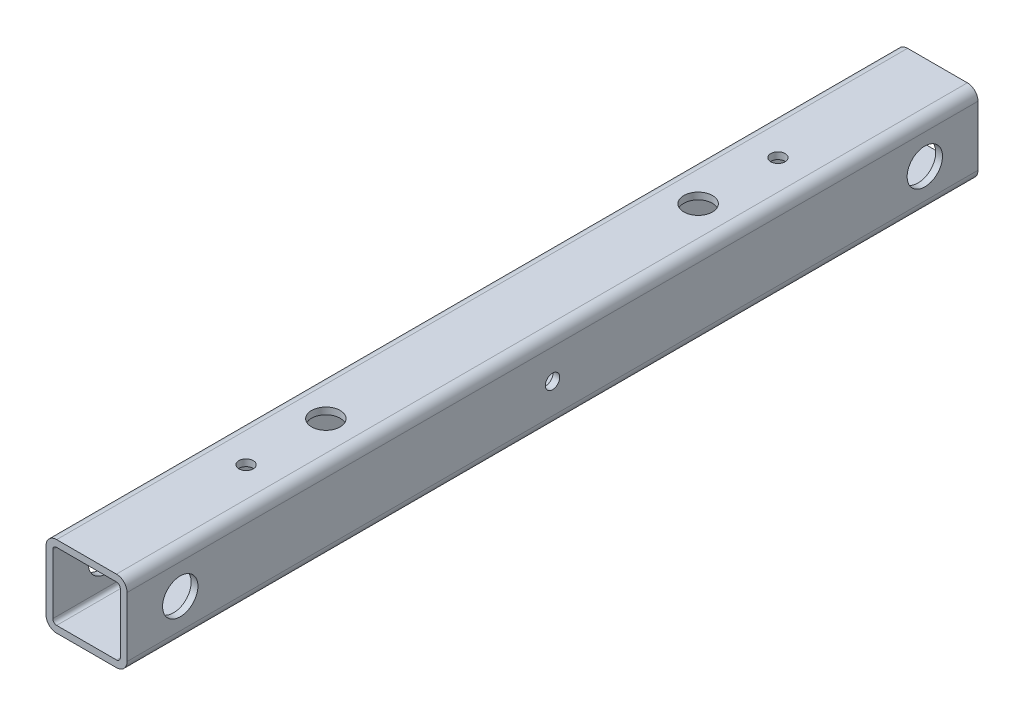
from build123d import *

# Parameters (mm, degrees)
BOSS_EXTRUDE1_DEPTH             = 400
CUT_EXTRUDE1_DEPTH              = 401.906229685
CUT_EXTRUDE1_DEPTH_BACK         = 401.906229685
SKETCH2_R                       = 8.3125
CUT_EXTRUDE2_DEPTH              = 401.906229685
CUT_EXTRUDE2_DEPTH_BACK         = 401.906229685
SKETCH3_R                       = 3.38
CUT_EXTRUDE3_DEPTH              = 401.906229685
CUT_EXTRUDE3_DEPTH_BACK         = 401.906229685
SKETCH4_R                       = 3.38
BROOM_MOUNTING_HOLES_DEPTH      = 401.906229685
BROOM_MOUNTING_HOLES_DEPTH_BACK = 401.906229685
SKETCH6_R                       = 6.725


with BuildPart() as part:
    # Sketch1 → Boss-Extrude1 (new body)
    with BuildSketch(Plane.XY):
        with BuildLine():
            Line((-14.05, 19.05), (14.05, 19.05))
            ThreePointArc((14.05, 19.05), (17.585533906, 17.585533906), (19.05, 14.05))
            Line((19.05, 14.05), (19.05, -14.05))
            ThreePointArc((19.05, -14.05), (17.585533906, -17.585533906), (14.05, -19.05))
            Line((14.05, -19.05), (-14.05, -19.05))
            ThreePointArc((-14.05, -19.05), (-17.585533906, -17.585533906), (-19.05, -14.05))
            Line((-19.05, -14.05), (-19.05, 14.05))
            ThreePointArc((-19.05, 14.05), (-17.585533906, 17.585533906), (-14.05, 19.05))
        make_face()
        with BuildLine():
            Line((-15.875, 14.05), (-15.875, -14.05))
            ThreePointArc((-15.875, -14.05), (-15.340469876, -15.340469876), (-14.05, -15.875))
            Line((-14.05, -15.875), (14.05, -15.875))
            ThreePointArc((14.05, -15.875), (15.340469876, -15.340469876), (15.875, -14.05))
            Line((15.875, -14.05), (15.875, 14.05))
            ThreePointArc((15.875, 14.05), (15.340469876, 15.340469876), (14.05, 15.875))
            Line((14.05, 15.875), (-14.05, 15.875))
            ThreePointArc((-14.05, 15.875), (-15.340469876, 15.340469876), (-15.875, 14.05))
        make_face(mode=Mode.SUBTRACT)
    extrude(amount=BOSS_EXTRUDE1_DEPTH)

    # Sketch2 → Cut-Extrude1 (cut, two sides: drawn at the far end of the back side and taken through both)
    with BuildSketch(Plane(origin=(0, 0, 0), x_dir=(0, 0, -1), z_dir=(1, 0, 0)).offset(-CUT_EXTRUDE1_DEPTH_BACK)):
        with Locations((-375, 0)):
            Circle(SKETCH2_R)
        with Locations((-25, 0)):
            Circle(SKETCH2_R)
    extrude(amount=CUT_EXTRUDE1_DEPTH + CUT_EXTRUDE1_DEPTH_BACK, mode=Mode.SUBTRACT)

    # Sketch3 → Cut-Extrude2 (cut, two sides: drawn at the far end of the back side and taken through both)
    with BuildSketch(Plane(origin=(0, 0, 0), x_dir=(1, 0, 0), z_dir=(0, 1, 0)).offset(-CUT_EXTRUDE2_DEPTH_BACK)):
        with Locations((0, -325)):
            Circle(SKETCH3_R)
        with Locations((0, -75)):
            Circle(SKETCH3_R)
    extrude(amount=CUT_EXTRUDE2_DEPTH + CUT_EXTRUDE2_DEPTH_BACK, mode=Mode.SUBTRACT)

    # Sketch4 → Cut-Extrude3 (cut, two sides: drawn at the far end of the back side and taken through both)
    with BuildSketch(Plane(origin=(0, 0, 0), x_dir=(0, 0, -1), z_dir=(1, 0, 0)).offset(-CUT_EXTRUDE3_DEPTH_BACK)):
        with Locations((-200, 0)):
            Circle(SKETCH4_R)
    extrude(amount=CUT_EXTRUDE3_DEPTH + CUT_EXTRUDE3_DEPTH_BACK, mode=Mode.SUBTRACT)

    # Sketch6 → Broom Mounting Holes (cut, two sides: drawn at the far end of the back side and taken through both)
    with BuildSketch(Plane(origin=(0, 0, 0), x_dir=(1, 0, 0), z_dir=(0, 1, 0)).offset(-BROOM_MOUNTING_HOLES_DEPTH_BACK)):
        with Locations((0, -112.5)):
            Circle(SKETCH6_R)
        with Locations((0, -287.5)):
            Circle(SKETCH6_R)
    extrude(amount=BROOM_MOUNTING_HOLES_DEPTH + BROOM_MOUNTING_HOLES_DEPTH_BACK, mode=Mode.SUBTRACT)


solid = part.part
